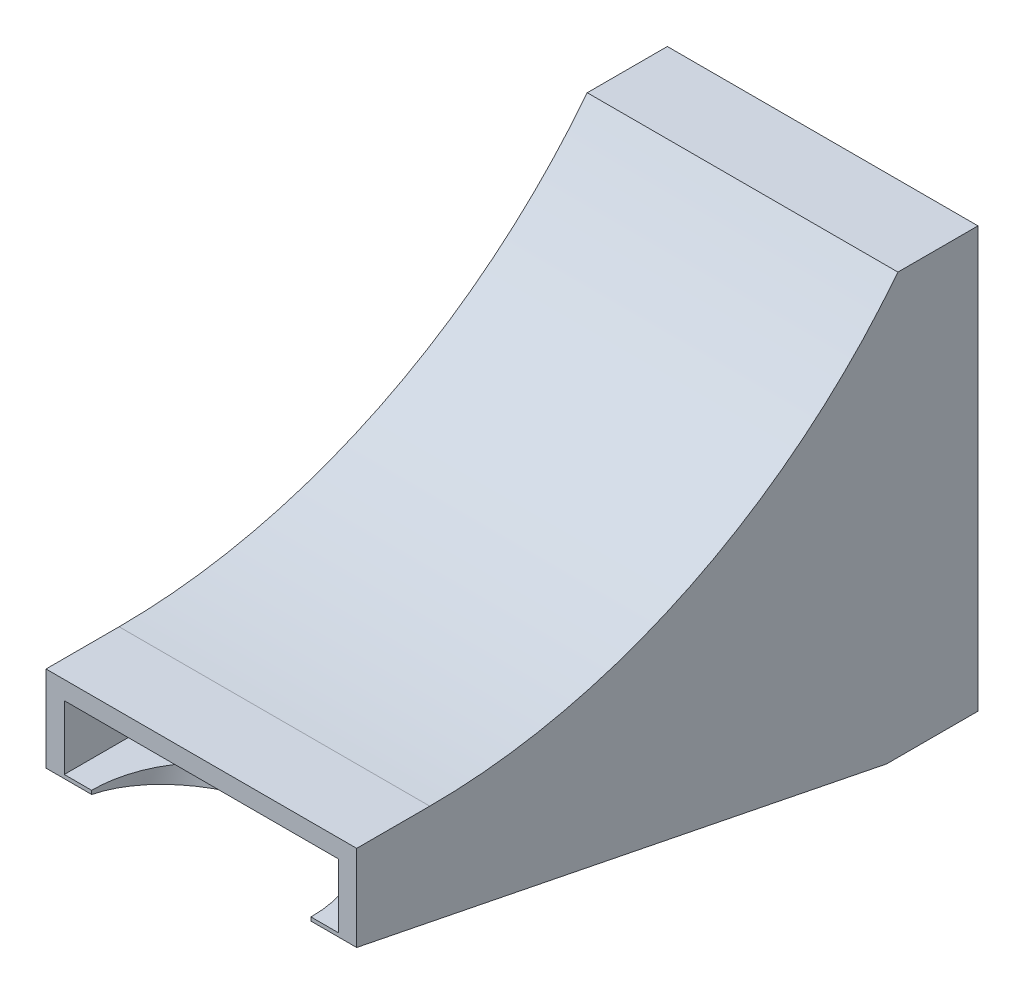
from build123d import *

# Parameters (mm, degrees)
SKETCH1_W           = 17
SKETCH1_H           = 23
SKETCH1_W_2         = 15
SKETCH1_H_2         = 21
BOSS_EXTRUDE1_DEPTH = 30
SKETCH2_R           = 32.5
CUT_EXTRUDE1_DEPTH  = 37.349002737
BOSS_EXTRUDE2_REACH = 38.349
CUT_EXTRUDE2_DEPTH  = 37.349002737
BOSS_EXTRUDE3_REACH = 38.349
SKETCH6_W           = 17
SKETCH6_H           = 5.5
SKETCH6_W_2         = 15
SKETCH6_H_2         = 3.5
BOSS_EXTRUDE4_DEPTH = 4
CUT_EXTRUDE3_DEPTH  = 40.714606885
CUT_EXTRUDE4_REACH  = 42.295
SKETCH8_R           = 6


with BuildPart() as part:
    # Sketch1 → Boss-Extrude1 (new body)
    with BuildSketch(Plane.XY):
        Rectangle(SKETCH1_W, SKETCH1_H)
        Rectangle(SKETCH1_W_2, SKETCH1_H_2, mode=Mode.SUBTRACT)
    extrude(amount=BOSS_EXTRUDE1_DEPTH)

    # Sketch2 → Cut-Extrude1 (cut, through all)
    with BuildSketch(Plane(origin=(8.5, 0, 0), x_dir=(0, 0, -1), z_dir=(1, 0, 0))):
        with Locations((-30, 31.5)):
            Circle(SKETCH2_R)
    extrude(amount=-CUT_EXTRUDE1_DEPTH, mode=Mode.SUBTRACT)

    # Sketch3 → Boss-Extrude2 (add, up to next)
    with BuildSketch(Plane(origin=(8.5, 0, 0), x_dir=(0, 0, -1), z_dir=(1, 0, 0)), mode=Mode.PRIVATE) as boss_extrude2_sk1:
        with BuildLine():
            Line((-30, -1), (-30, -2))
            ThreePointArc((-30, -2), (-14.962546758, 1.564653), (-3.125290699, 11.5))
            Line((-3.125290699, 11.5), (-4.382623085, 11.5))
            ThreePointArc((-4.382623085, 11.5), (-15.747807186, 2.291696386), (-30, -1))
        make_face()
    boss_extrude2_tool1 = extrude(boss_extrude2_sk1.sketch, amount=-BOSS_EXTRUDE2_REACH, mode=Mode.PRIVATE) - part.part
    add(boss_extrude2_tool1.solids().sort_by_distance((8.5, -1.5, 29.699251))[0])

    # Sketch4 → Cut-Extrude2 (cut, through all)
    with BuildSketch(Plane.ZY.offset(8.5)):
        Polygon((5, -11.5), (30, -6.5), (30, -11.5), align=None)
    extrude(amount=-CUT_EXTRUDE2_DEPTH, mode=Mode.SUBTRACT)

    # Sketch5 → Boss-Extrude3 (add, up to next)
    with BuildSketch(Plane.ZY.offset(8.5), mode=Mode.PRIVATE) as boss_extrude3_sk1:
        Polygon((5, -11.5), (30, -6.5), (30, -5.5), (0, -11.5), align=None)
    boss_extrude3_tool1 = extrude(boss_extrude3_sk1.sketch, amount=-BOSS_EXTRUDE3_REACH, mode=Mode.PRIVATE) - part.part
    add(boss_extrude3_tool1.solids().sort_by_distance((-8.5, -8.742424, 16.212121))[0])

    # Sketch6 → Boss-Extrude4 (add)
    with BuildSketch(Plane.XY.offset(30)):
        with Locations((0, -3.75)):
            Rectangle(SKETCH6_W, SKETCH6_H)
        with Locations((0, -3.75)):
            Rectangle(SKETCH6_W_2, SKETCH6_H_2, mode=Mode.SUBTRACT)
    extrude(amount=BOSS_EXTRUDE4_DEPTH)

    # Sketch7 → Cut-Extrude3 (cut, through all)
    with BuildSketch(Plane.ZY.offset(8.5)):
        Polygon((24, -7.7), (34, -5.7), (34, -7.7), align=None)
    extrude(amount=-CUT_EXTRUDE3_DEPTH, mode=Mode.SUBTRACT)

    # Sketch8 → Cut-Extrude4 (cut, up to next)
    with BuildSketch(Plane(origin=(0, -12.019230769, 2.403846154), x_dir=(1, 0, 0), z_dir=(0, -0.9805806756909202, 0.19611613513818413)), mode=Mode.PRIVATE) as cut_extrude4_sk1:
        with Locations((0, 32.221881003)):
            Circle(SKETCH8_R)
    cut_extrude4_tool1 = extrude(cut_extrude4_sk1.sketch, amount=-CUT_EXTRUDE4_REACH, mode=Mode.PRIVATE) & part.part
    add(cut_extrude4_tool1.solids().sort_by_distance((0, -5.7, 34))[0], mode=Mode.SUBTRACT)


solid = part.part
